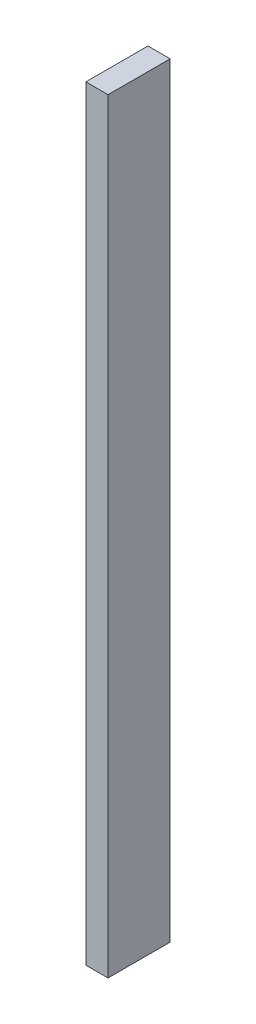
from build123d import *

# Parameters (mm, degrees)
SKETCH1_W           = 3.175
SKETCH1_H           = 8.89
BOSS_EXTRUDE1_DEPTH = 109.474


with BuildPart() as part:
    # Sketch1 → Boss-Extrude1 (new body)
    with BuildSketch(Plane(origin=(0, 0, 0), x_dir=(1, 0, 0), z_dir=(0, 1, 0))):
        with Locations((1.5875, 4.445)):
            Rectangle(SKETCH1_W, SKETCH1_H)
    extrude(amount=BOSS_EXTRUDE1_DEPTH)


solid = part.part
